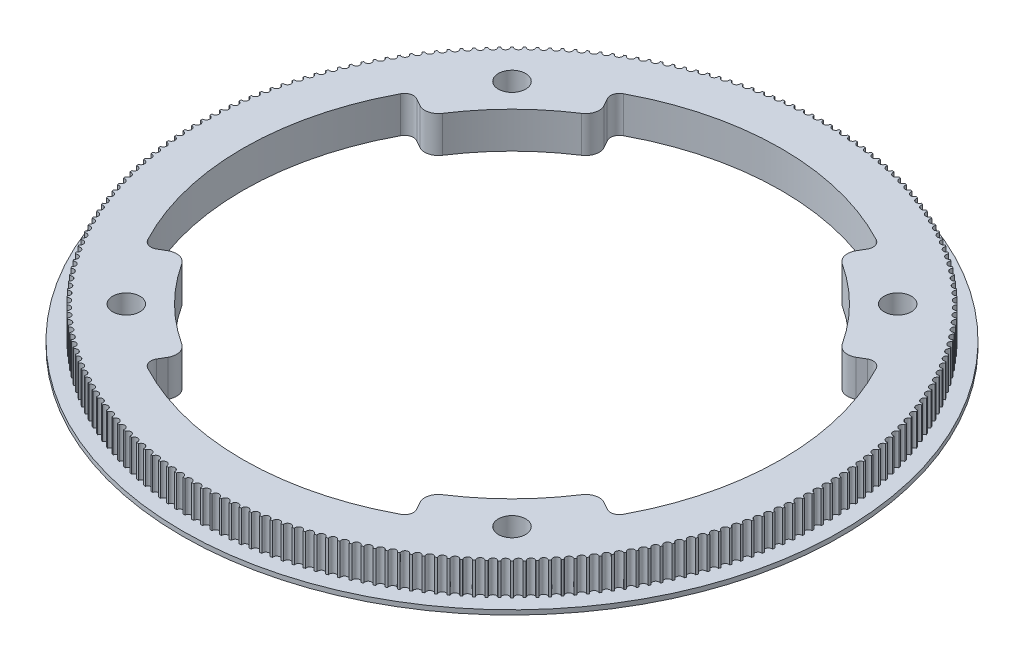
from build123d import *

# Parameters (mm, degrees)
BOSS_EXTRUDE1_DEPTH = 7
SKETCH3_R           = 72.5
BOSS_EXTRUDE3_DEPTH = 1
SKETCH6_R           = 3
CUT_EXTRUDE3_DEPTH  = 103.842111997
SKETCH7_R           = 50
CUT_EXTRUDE4_DEPTH  = 103.842111997
CUT_EXTRUDE5_DEPTH  = 103.842111997
SKETCH11_R          = 52.5
CUT_EXTRUDE6_DEPTH  = 10
FILLET1_R           = 3
FILLET2_R           = 2


with BuildPart() as part:
    # Sketch1 → Boss-Extrude1 (new body)
    with BuildSketch(Plane(origin=(0, 0, 0), x_dir=(1, 0, 0), z_dir=(0, 1, 0))):
        with BuildLine():
            ThreePointArc((-0.759988559, 69.250829904), (-0.988925477, 69.247938969), (-1.217851586, 69.244291191))
            ThreePointArc((-1.217851586, 69.244291191), (-1.955946699, 68.467067248), (-2.737208847, 69.200886647))
            ThreePointArc((-2.737208847, 69.200886647), (-2.965969848, 69.191459356), (-3.194698434, 69.18127584))
            ThreePointArc((-3.194698434, 69.18127584), (-3.9102981, 68.383291773), (-4.712196627, 69.094502154))
            ThreePointArc((-4.712196627, 69.094502154), (-4.940595132, 69.078546197), (-5.168939639, 69.061835249))
            ThreePointArc((-5.168939639, 69.061835249), (-5.861460206, 68.243741905), (-6.683341073, 68.931763195))
            ThreePointArc((-6.683341073, 68.931763195), (-6.911190796, 68.909291585), (-7.138964984, 68.886066835))
            ThreePointArc((-7.138964984, 68.886066835), (-7.80784162, 68.048531463), (-8.64903449, 68.7128025))
            ThreePointArc((-8.64903449, 68.7128025), (-8.876149594, 68.683833566), (-9.103167686, 68.654113956))
            ThreePointArc((-9.103167686, 68.654113956), (-9.747854848, 67.797819662), (-10.60767363, 68.437798658))
            ThreePointArc((-10.60767363, 68.437798658), (-10.833868876, 68.402356028), (-11.059945715, 68.366165797))
            ThreePointArc((-11.059945715, 68.366165797), (-11.679917584, 67.491810986), (-12.557660999, 68.106975966))
            ThreePointArc((-12.557660999, 68.106975966), (-12.7827519, 68.065088547), (-13.007703093, 68.022457213))
            ThreePointArc((-13.007703093, 68.022457213), (-13.602454013, 67.130755022), (-14.49740616, 67.720604247))
            ThreePointArc((-14.49740616, 67.720604247), (-14.721209128, 67.672306203), (-14.944851201, 67.623268537))
            ThreePointArc((-14.944851201, 67.623268537), (-15.513896085, 66.714946251), (-16.425327028, 67.278998633))
            ThreePointArc((-16.425327028, 67.278998633), (-16.647659527, 67.224329355), (-16.869810075, 67.168925353))
            ThreePointArc((-16.869810075, 67.168925353), (-17.412684801, 66.244723813), (-18.339851164, 66.782519302))
            ThreePointArc((-18.339851164, 66.782519302), (-18.560531855, 66.721523381), (-18.78100969, 66.65979823))
            ThreePointArc((-18.78100969, 66.65979823), (-19.297271481, 65.720471228), (-20.239417055, 66.23157119))
            ThreePointArc((-20.239417055, 66.23157119), (-20.458265948, 66.164298375), (-20.676891243, 66.096302419))
            ThreePointArc((-20.676891243, 66.096302419), (-21.16611903, 65.142616084), (-22.122475387, 65.626603659))
            ThreePointArc((-22.122475387, 65.626603659), (-22.339313986, 65.553108818), (-22.555908428, 65.478897517))
            ThreePointArc((-22.555908428, 65.478897517), (-23.017703188, 64.511629687), (-23.98749031, 64.968110128))
            ThreePointArc((-23.98749031, 64.968110128), (-24.202141758, 64.888453205), (-24.41652869, 64.808087086))
            ThreePointArc((-24.41652869, 64.808087086), (-24.850513778, 63.828026681), (-25.832940692, 64.256627675))
            ThreePointArc((-25.832940692, 64.256627675), (-26.045229917, 64.170873639), (-26.257234481, 64.08441825))
            ThreePointArc((-26.257234481, 64.08441825), (-26.663055932, 63.09236462), (-27.657321357, 63.492736595))
            ThreePointArc((-27.657321357, 63.492736595), (-27.867075212, 63.400955388), (-28.076524495, 63.308481243))
            ThreePointArc((-28.076524495, 63.308481243), (-28.453851316, 62.305243522), (-29.459144315, 62.677059928))
            ThreePointArc((-29.459144315, 62.677059928), (-29.666191722, 62.579326408), (-29.872914893, 62.48090893))
            ThreePointArc((-29.872914893, 62.48090893), (-30.22143933, 61.467305373), (-31.236939971, 61.810262952))
            ThreePointArc((-31.236939971, 61.810262952), (-31.441112059, 61.706656833), (-31.644940513, 61.602376293))
            ThreePointArc((-31.644940513, 61.602376293), (-31.964378304, 60.579233609), (-32.989258331, 60.893052639))
            ThreePointArc((-32.989258331, 60.893052639), (-33.190388575, 60.783658422), (-33.391156066, 60.673599873))
            ThreePointArc((-33.391156066, 60.673599873), (-33.681246674, 59.641752552), (-34.71467018, 59.926177079))
            ThreePointArc((-34.71467018, 59.926177079), (-34.912594534, 59.811083989), (-35.110137313, 59.695337195))
            ThreePointArc((-35.110137313, 59.695337195), (-35.370644135, 58.655626827), (-36.411768245, 58.910424869))
            ThreePointArc((-36.411768245, 58.910424869), (-36.60632528, 58.789726777), (-36.800482228, 58.668386144))
            ThreePointArc((-36.800482228, 58.668386144), (-37.031192792, 57.621660731), (-38.079168349, 57.846624472))
            ThreePointArc((-38.079168349, 57.846624472), (-38.270199382, 57.72041982), (-38.460812142, 57.593584316))
            ThreePointArc((-38.460812142, 57.593584316), (-38.661538276, 56.540697582), (-39.715510538, 56.735643538))
            ThreePointArc((-39.715510538, 56.735643538), (-39.902859761, 56.604035262), (-40.089772867, 56.471808334))
            ThreePointArc((-40.089772867, 56.471808334), (-40.260350856, 55.41361903), (-41.319460187, 55.5783882))
            ThreePointArc((-41.319460187, 55.5783882), (-41.502974794, 55.44148364), (-41.686035797, 55.303973135))
            ThreePointArc((-41.686035797, 55.303973135), (-41.826326516, 54.241344334), (-42.889709091, 54.375802331))
            ThreePointArc((-42.889709091, 54.375802331), (-43.069239406, 54.233713149), (-43.248298998, 54.091031223))
            ThreePointArc((-43.248298998, 54.091031223), (-43.358188024, 53.024829621), (-44.424976533, 53.128866777))
            ThreePointArc((-44.424976533, 53.128866777), (-44.600376129, 52.981708864), (-44.775288267, 52.833971889))
            ThreePointArc((-44.775288267, 52.833971889), (-44.854685972, 51.765067095), (-45.924010327, 51.838598558))
            ThreePointArc((-45.924010327, 51.838598558), (-46.095136145, 51.686491937), (-46.265758168, 51.533820411))
            ThreePointArc((-46.265758168, 51.533820411), (-46.314599794, 50.463084239), (-47.38558784, 50.506050034))
            ThreePointArc((-47.38558784, 50.506050034), (-47.552300307, 50.349118766), (-47.718493053, 50.191637209))
            ThreePointArc((-47.718493053, 50.191637209), (-47.736738765, 49.119942967), (-48.808516988, 49.132308051))
            ThreePointArc((-48.808516988, 49.132308051), (-48.970680131, 48.970680131), (-49.132308051, 48.808516988))
            ThreePointArc((-49.132308051, 48.808516988), (-49.119942967, 47.736738765), (-50.191637209, 47.718493053))
            ThreePointArc((-50.191637209, 47.718493053), (-50.349118766, 47.552300307), (-50.506050034, 47.38558784))
            ThreePointArc((-50.506050034, 47.38558784), (-50.463084239, 46.314599794), (-51.533820411, 46.265758168))
            ThreePointArc((-51.533820411, 46.265758168), (-51.686491937, 46.095136145), (-51.838598558, 45.924010327))
            ThreePointArc((-51.838598558, 45.924010327), (-51.765067095, 44.854685972), (-52.833971889, 44.775288267))
            ThreePointArc((-52.833971889, 44.775288267), (-52.981708864, 44.600376129), (-53.128866777, 44.424976533))
            ThreePointArc((-53.128866777, 44.424976533), (-53.024829621, 43.358188024), (-54.091031223, 43.248298998))
            ThreePointArc((-54.091031223, 43.248298998), (-54.233713149, 43.069239406), (-54.375802331, 42.889709091))
            ThreePointArc((-54.375802331, 42.889709091), (-54.241344334, 41.826326516), (-55.303973135, 41.686035797))
            ThreePointArc((-55.303973135, 41.686035797), (-55.44148364, 41.502974794), (-55.5783882, 41.319460187))
            ThreePointArc((-55.5783882, 41.319460187), (-55.41361903, 40.260350856), (-56.471808334, 40.089772867))
            ThreePointArc((-56.471808334, 40.089772867), (-56.604035262, 39.902859761), (-56.735643538, 39.715510538))
            ThreePointArc((-56.735643538, 39.715510538), (-56.540697582, 38.661538276), (-57.593584316, 38.460812142))
            ThreePointArc((-57.593584316, 38.460812142), (-57.72041982, 38.270199382), (-57.846624472, 38.079168349))
            ThreePointArc((-57.846624472, 38.079168349), (-57.621660731, 37.031192792), (-58.668386144, 36.800482228))
            ThreePointArc((-58.668386144, 36.800482228), (-58.789726777, 36.60632528), (-58.910424869, 36.411768245))
            ThreePointArc((-58.910424869, 36.411768245), (-58.655626827, 35.370644135), (-59.695337195, 35.110137313))
            ThreePointArc((-59.695337195, 35.110137313), (-59.811083989, 34.912594534), (-59.926177079, 34.71467018))
            ThreePointArc((-59.926177079, 34.71467018), (-59.641752552, 33.681246674), (-60.673599873, 33.391156066))
            ThreePointArc((-60.673599873, 33.391156066), (-60.783658422, 33.190388575), (-60.893052639, 32.989258331))
            ThreePointArc((-60.893052639, 32.989258331), (-60.579233609, 31.964378304), (-61.602376293, 31.644940513))
            ThreePointArc((-61.602376293, 31.644940513), (-61.706656833, 31.441112059), (-61.810262952, 31.236939971))
            ThreePointArc((-61.810262952, 31.236939971), (-61.467305373, 30.22143933), (-62.48090893, 29.872914893))
            ThreePointArc((-62.48090893, 29.872914893), (-62.579326408, 29.666191722), (-62.677059928, 29.459144315))
            ThreePointArc((-62.677059928, 29.459144315), (-62.305243522, 28.453851316), (-63.308481243, 28.076524495))
            ThreePointArc((-63.308481243, 28.076524495), (-63.400955388, 27.867075212), (-63.492736595, 27.657321357))
            ThreePointArc((-63.492736595, 27.657321357), (-63.09236462, 26.663055932), (-64.08441825, 26.257234481))
            ThreePointArc((-64.08441825, 26.257234481), (-64.170873639, 26.045229917), (-64.256627675, 25.832940692))
            ThreePointArc((-64.256627675, 25.832940692), (-63.828026681, 24.850513778), (-64.808087086, 24.41652869))
            ThreePointArc((-64.808087086, 24.41652869), (-64.888453205, 24.202141758), (-64.968110128, 23.98749031))
            ThreePointArc((-64.968110128, 23.98749031), (-64.511629687, 23.017703188), (-65.478897517, 22.555908428))
            ThreePointArc((-65.478897517, 22.555908428), (-65.553108818, 22.339313986), (-65.626603659, 22.122475387))
            ThreePointArc((-65.626603659, 22.122475387), (-65.142616084, 21.16611903), (-66.096302419, 20.676891243))
            ThreePointArc((-66.096302419, 20.676891243), (-66.164298375, 20.458265948), (-66.23157119, 20.239417055))
            ThreePointArc((-66.23157119, 20.239417055), (-65.720471228, 19.297271481), (-66.65979823, 18.78100969))
            ThreePointArc((-66.65979823, 18.78100969), (-66.721523381, 18.560531855), (-66.782519302, 18.339851164))
            ThreePointArc((-66.782519302, 18.339851164), (-66.244723813, 17.412684801), (-67.168925353, 16.869810075))
            ThreePointArc((-67.168925353, 16.869810075), (-67.224329355, 16.647659527), (-67.278998633, 16.425327028))
            ThreePointArc((-67.278998633, 16.425327028), (-66.714946251, 15.513896085), (-67.623268537, 14.944851201))
            ThreePointArc((-67.623268537, 14.944851201), (-67.672306203, 14.721209128), (-67.720604247, 14.49740616))
            ThreePointArc((-67.720604247, 14.49740616), (-67.130755022, 13.602454013), (-68.022457213, 13.007703093))
            ThreePointArc((-68.022457213, 13.007703093), (-68.065088547, 12.7827519), (-68.106975966, 12.557660999))
            ThreePointArc((-68.106975966, 12.557660999), (-67.491810986, 11.679917584), (-68.366165797, 11.059945715))
            ThreePointArc((-68.366165797, 11.059945715), (-68.402356028, 10.833868876), (-68.437798658, 10.60767363))
            ThreePointArc((-68.437798658, 10.60767363), (-67.797819662, 9.747854848), (-68.654113956, 9.103167686))
            ThreePointArc((-68.654113956, 9.103167686), (-68.683833566, 8.876149594), (-68.7128025, 8.64903449))
            ThreePointArc((-68.7128025, 8.64903449), (-68.048531463, 7.80784162), (-68.886066835, 7.138964984))
            ThreePointArc((-68.886066835, 7.138964984), (-68.909291585, 6.911190796), (-68.931763195, 6.683341073))
            ThreePointArc((-68.931763195, 6.683341073), (-68.243741905, 5.861460206), (-69.061835249, 5.168939639))
            ThreePointArc((-69.061835249, 5.168939639), (-69.078546197, 4.940595132), (-69.094502154, 4.712196627))
            ThreePointArc((-69.094502154, 4.712196627), (-68.383291773, 3.9102981), (-69.18127584, 3.194698434))
            ThreePointArc((-69.18127584, 3.194698434), (-69.191459356, 2.965969848), (-69.200886647, 2.737208847))
            ThreePointArc((-69.200886647, 2.737208847), (-68.467067248, 1.955946699), (-69.244291191, 1.217851586))
            ThreePointArc((-69.244291191, 1.217851586), (-69.247938969, 0.988925477), (-69.250829904, 0.759988559))
            ThreePointArc((-69.250829904, 0.759988559), (-68.495, 0), (-69.250829904, -0.759988559))
            ThreePointArc((-69.250829904, -0.759988559), (-69.247938969, -0.988925477), (-69.244291191, -1.217851586))
            ThreePointArc((-69.244291191, -1.217851586), (-68.467067248, -1.955946699), (-69.200886647, -2.737208847))
            ThreePointArc((-69.200886647, -2.737208847), (-69.191459356, -2.965969848), (-69.18127584, -3.194698434))
            ThreePointArc((-69.18127584, -3.194698434), (-68.383291773, -3.9102981), (-69.094502154, -4.712196627))
            ThreePointArc((-69.094502154, -4.712196627), (-69.078546197, -4.940595132), (-69.061835249, -5.168939639))
            ThreePointArc((-69.061835249, -5.168939639), (-68.243741905, -5.861460206), (-68.931763195, -6.683341073))
            ThreePointArc((-68.931763195, -6.683341073), (-68.909291585, -6.911190796), (-68.886066835, -7.138964984))
            ThreePointArc((-68.886066835, -7.138964984), (-68.048531463, -7.80784162), (-68.7128025, -8.64903449))
            ThreePointArc((-68.7128025, -8.64903449), (-68.683833566, -8.876149594), (-68.654113956, -9.103167686))
            ThreePointArc((-68.654113956, -9.103167686), (-67.797819662, -9.747854848), (-68.437798658, -10.60767363))
            ThreePointArc((-68.437798658, -10.60767363), (-68.402356028, -10.833868876), (-68.366165797, -11.059945715))
            ThreePointArc((-68.366165797, -11.059945715), (-67.491810986, -11.679917584), (-68.106975966, -12.557660999))
            ThreePointArc((-68.106975966, -12.557660999), (-68.065088547, -12.7827519), (-68.022457213, -13.007703093))
            ThreePointArc((-68.022457213, -13.007703093), (-67.130755022, -13.602454013), (-67.720604247, -14.49740616))
            ThreePointArc((-67.720604247, -14.49740616), (-67.672306203, -14.721209128), (-67.623268537, -14.944851201))
            ThreePointArc((-67.623268537, -14.944851201), (-66.714946251, -15.513896085), (-67.278998633, -16.425327028))
            ThreePointArc((-67.278998633, -16.425327028), (-67.224329355, -16.647659527), (-67.168925353, -16.869810075))
            ThreePointArc((-67.168925353, -16.869810075), (-66.244723813, -17.412684801), (-66.782519302, -18.339851164))
            ThreePointArc((-66.782519302, -18.339851164), (-66.721523381, -18.560531855), (-66.65979823, -18.78100969))
            ThreePointArc((-66.65979823, -18.78100969), (-65.720471228, -19.297271481), (-66.23157119, -20.239417055))
            ThreePointArc((-66.23157119, -20.239417055), (-66.164298375, -20.458265948), (-66.096302419, -20.676891243))
            ThreePointArc((-66.096302419, -20.676891243), (-65.142616084, -21.16611903), (-65.626603659, -22.122475387))
            ThreePointArc((-65.626603659, -22.122475387), (-65.553108818, -22.339313986), (-65.478897517, -22.555908428))
            ThreePointArc((-65.478897517, -22.555908428), (-64.511629687, -23.017703188), (-64.968110128, -23.98749031))
            ThreePointArc((-64.968110128, -23.98749031), (-64.888453205, -24.202141758), (-64.808087086, -24.41652869))
            ThreePointArc((-64.808087086, -24.41652869), (-63.828026681, -24.850513778), (-64.256627675, -25.832940692))
            ThreePointArc((-64.256627675, -25.832940692), (-64.170873639, -26.045229917), (-64.08441825, -26.257234481))
            ThreePointArc((-64.08441825, -26.257234481), (-63.09236462, -26.663055932), (-63.492736595, -27.657321357))
            ThreePointArc((-63.492736595, -27.657321357), (-63.400955388, -27.867075212), (-63.308481243, -28.076524495))
            ThreePointArc((-63.308481243, -28.076524495), (-62.305243522, -28.453851316), (-62.677059928, -29.459144315))
            ThreePointArc((-62.677059928, -29.459144315), (-62.579326408, -29.666191722), (-62.48090893, -29.872914893))
            ThreePointArc((-62.48090893, -29.872914893), (-61.467305373, -30.22143933), (-61.810262952, -31.236939971))
            ThreePointArc((-61.810262952, -31.236939971), (-61.706656833, -31.441112059), (-61.602376293, -31.644940513))
            ThreePointArc((-61.602376293, -31.644940513), (-60.579233609, -31.964378304), (-60.893052639, -32.989258331))
            ThreePointArc((-60.893052639, -32.989258331), (-60.783658422, -33.190388575), (-60.673599873, -33.391156066))
            ThreePointArc((-60.673599873, -33.391156066), (-59.641752552, -33.681246674), (-59.926177079, -34.71467018))
            ThreePointArc((-59.926177079, -34.71467018), (-59.811083989, -34.912594534), (-59.695337195, -35.110137313))
            ThreePointArc((-59.695337195, -35.110137313), (-58.655626827, -35.370644135), (-58.910424869, -36.411768245))
            ThreePointArc((-58.910424869, -36.411768245), (-58.789726777, -36.60632528), (-58.668386144, -36.800482228))
            ThreePointArc((-58.668386144, -36.800482228), (-57.621660731, -37.031192792), (-57.846624472, -38.079168349))
            ThreePointArc((-57.846624472, -38.079168349), (-57.72041982, -38.270199382), (-57.593584316, -38.460812142))
            ThreePointArc((-57.593584316, -38.460812142), (-56.540697582, -38.661538276), (-56.735643538, -39.715510538))
            ThreePointArc((-56.735643538, -39.715510538), (-56.604035262, -39.902859761), (-56.471808334, -40.089772867))
            ThreePointArc((-56.471808334, -40.089772867), (-55.41361903, -40.260350856), (-55.5783882, -41.319460187))
            ThreePointArc((-55.5783882, -41.319460187), (-55.44148364, -41.502974794), (-55.303973135, -41.686035797))
            ThreePointArc((-55.303973135, -41.686035797), (-54.241344334, -41.826326516), (-54.375802331, -42.889709091))
            ThreePointArc((-54.375802331, -42.889709091), (-54.233713149, -43.069239406), (-54.091031223, -43.248298998))
            ThreePointArc((-54.091031223, -43.248298998), (-53.024829621, -43.358188024), (-53.128866777, -44.424976533))
            ThreePointArc((-53.128866777, -44.424976533), (-52.981708864, -44.600376129), (-52.833971889, -44.775288267))
            ThreePointArc((-52.833971889, -44.775288267), (-51.765067095, -44.854685972), (-51.838598558, -45.924010327))
            ThreePointArc((-51.838598558, -45.924010327), (-51.686491937, -46.095136145), (-51.533820411, -46.265758168))
            ThreePointArc((-51.533820411, -46.265758168), (-50.463084239, -46.314599794), (-50.506050034, -47.38558784))
            ThreePointArc((-50.506050034, -47.38558784), (-50.349118766, -47.552300307), (-50.191637209, -47.718493053))
            ThreePointArc((-50.191637209, -47.718493053), (-49.119942967, -47.736738765), (-49.132308051, -48.808516988))
            ThreePointArc((-49.132308051, -48.808516988), (-48.970680131, -48.970680131), (-48.808516988, -49.132308051))
            ThreePointArc((-48.808516988, -49.132308051), (-47.736738765, -49.119942967), (-47.718493053, -50.191637209))
            ThreePointArc((-47.718493053, -50.191637209), (-47.552300307, -50.349118766), (-47.38558784, -50.506050034))
            ThreePointArc((-47.38558784, -50.506050034), (-46.314599794, -50.463084239), (-46.265758168, -51.533820411))
            ThreePointArc((-46.265758168, -51.533820411), (-46.095136145, -51.686491937), (-45.924010327, -51.838598558))
            ThreePointArc((-45.924010327, -51.838598558), (-44.854685972, -51.765067095), (-44.775288267, -52.833971889))
            ThreePointArc((-44.775288267, -52.833971889), (-44.600376129, -52.981708864), (-44.424976533, -53.128866777))
            ThreePointArc((-44.424976533, -53.128866777), (-43.358188024, -53.024829621), (-43.248298998, -54.091031223))
            ThreePointArc((-43.248298998, -54.091031223), (-43.069239406, -54.233713149), (-42.889709091, -54.375802331))
            ThreePointArc((-42.889709091, -54.375802331), (-41.826326516, -54.241344334), (-41.686035797, -55.303973135))
            ThreePointArc((-41.686035797, -55.303973135), (-41.502974794, -55.44148364), (-41.319460187, -55.5783882))
            ThreePointArc((-41.319460187, -55.5783882), (-40.260350856, -55.41361903), (-40.089772867, -56.471808334))
            ThreePointArc((-40.089772867, -56.471808334), (-39.902859761, -56.604035262), (-39.715510538, -56.735643538))
            ThreePointArc((-39.715510538, -56.735643538), (-38.661538276, -56.540697582), (-38.460812142, -57.593584316))
            ThreePointArc((-38.460812142, -57.593584316), (-38.270199382, -57.72041982), (-38.079168349, -57.846624472))
            ThreePointArc((-38.079168349, -57.846624472), (-37.031192792, -57.621660731), (-36.800482228, -58.668386144))
            ThreePointArc((-36.800482228, -58.668386144), (-36.60632528, -58.789726777), (-36.411768245, -58.910424869))
            ThreePointArc((-36.411768245, -58.910424869), (-35.370644135, -58.655626827), (-35.110137313, -59.695337195))
            ThreePointArc((-35.110137313, -59.695337195), (-34.912594534, -59.811083989), (-34.71467018, -59.926177079))
            ThreePointArc((-34.71467018, -59.926177079), (-33.681246674, -59.641752552), (-33.391156066, -60.673599873))
            ThreePointArc((-33.391156066, -60.673599873), (-33.190388575, -60.783658422), (-32.989258331, -60.893052639))
            ThreePointArc((-32.989258331, -60.893052639), (-31.964378304, -60.579233609), (-31.644940513, -61.602376293))
            ThreePointArc((-31.644940513, -61.602376293), (-31.441112059, -61.706656833), (-31.236939971, -61.810262952))
            ThreePointArc((-31.236939971, -61.810262952), (-30.22143933, -61.467305373), (-29.872914893, -62.48090893))
            ThreePointArc((-29.872914893, -62.48090893), (-29.666191722, -62.579326408), (-29.459144315, -62.677059928))
            ThreePointArc((-29.459144315, -62.677059928), (-28.453851316, -62.305243522), (-28.076524495, -63.308481243))
            ThreePointArc((-28.076524495, -63.308481243), (-27.867075212, -63.400955388), (-27.657321357, -63.492736595))
            ThreePointArc((-27.657321357, -63.492736595), (-26.663055932, -63.09236462), (-26.257234481, -64.08441825))
            ThreePointArc((-26.257234481, -64.08441825), (-26.045229917, -64.170873639), (-25.832940692, -64.256627675))
            ThreePointArc((-25.832940692, -64.256627675), (-24.850513778, -63.828026681), (-24.41652869, -64.808087086))
            ThreePointArc((-24.41652869, -64.808087086), (-24.202141758, -64.888453205), (-23.98749031, -64.968110128))
            ThreePointArc((-23.98749031, -64.968110128), (-23.017703188, -64.511629687), (-22.555908428, -65.478897517))
            ThreePointArc((-22.555908428, -65.478897517), (-22.339313986, -65.553108818), (-22.122475387, -65.626603659))
            ThreePointArc((-22.122475387, -65.626603659), (-21.16611903, -65.142616084), (-20.676891243, -66.096302419))
            ThreePointArc((-20.676891243, -66.096302419), (-20.458265948, -66.164298375), (-20.239417055, -66.23157119))
            ThreePointArc((-20.239417055, -66.23157119), (-19.297271481, -65.720471228), (-18.78100969, -66.65979823))
            ThreePointArc((-18.78100969, -66.65979823), (-18.560531855, -66.721523381), (-18.339851164, -66.782519302))
            ThreePointArc((-18.339851164, -66.782519302), (-17.412684801, -66.244723813), (-16.869810075, -67.168925353))
            ThreePointArc((-16.869810075, -67.168925353), (-16.647659527, -67.224329355), (-16.425327028, -67.278998633))
            ThreePointArc((-16.425327028, -67.278998633), (-15.513896085, -66.714946251), (-14.944851201, -67.623268537))
            ThreePointArc((-14.944851201, -67.623268537), (-14.721209128, -67.672306203), (-14.49740616, -67.720604247))
            ThreePointArc((-14.49740616, -67.720604247), (-13.602454013, -67.130755022), (-13.007703093, -68.022457213))
            ThreePointArc((-13.007703093, -68.022457213), (-12.7827519, -68.065088547), (-12.557660999, -68.106975966))
            ThreePointArc((-12.557660999, -68.106975966), (-11.679917584, -67.491810986), (-11.059945715, -68.366165797))
            ThreePointArc((-11.059945715, -68.366165797), (-10.833868876, -68.402356028), (-10.60767363, -68.437798658))
            ThreePointArc((-10.60767363, -68.437798658), (-9.747854848, -67.797819662), (-9.103167686, -68.654113956))
            ThreePointArc((-9.103167686, -68.654113956), (-8.876149594, -68.683833566), (-8.64903449, -68.7128025))
            ThreePointArc((-8.64903449, -68.7128025), (-7.80784162, -68.048531463), (-7.138964984, -68.886066835))
            ThreePointArc((-7.138964984, -68.886066835), (-6.911190796, -68.909291585), (-6.683341073, -68.931763195))
            ThreePointArc((-6.683341073, -68.931763195), (-5.861460206, -68.243741905), (-5.168939639, -69.061835249))
            ThreePointArc((-5.168939639, -69.061835249), (-4.940595132, -69.078546197), (-4.712196627, -69.094502154))
            ThreePointArc((-4.712196627, -69.094502154), (-3.9102981, -68.383291773), (-3.194698434, -69.18127584))
            ThreePointArc((-3.194698434, -69.18127584), (-2.965969848, -69.191459356), (-2.737208847, -69.200886647))
            ThreePointArc((-2.737208847, -69.200886647), (-1.955946699, -68.467067248), (-1.217851586, -69.244291191))
            ThreePointArc((-1.217851586, -69.244291191), (-0.988925477, -69.247938969), (-0.759988559, -69.250829904))
            ThreePointArc((-0.759988559, -69.250829904), (0, -68.495), (0.759988559, -69.250829904))
            ThreePointArc((0.759988559, -69.250829904), (0.988925477, -69.247938969), (1.217851586, -69.244291191))
            ThreePointArc((1.217851586, -69.244291191), (1.955946699, -68.467067248), (2.737208847, -69.200886647))
            ThreePointArc((2.737208847, -69.200886647), (2.965969848, -69.191459356), (3.194698434, -69.18127584))
            ThreePointArc((3.194698434, -69.18127584), (3.9102981, -68.383291773), (4.712196627, -69.094502154))
            ThreePointArc((4.712196627, -69.094502154), (4.940595132, -69.078546197), (5.168939639, -69.061835249))
            ThreePointArc((5.168939639, -69.061835249), (5.861460206, -68.243741905), (6.683341073, -68.931763195))
            ThreePointArc((6.683341073, -68.931763195), (6.911190796, -68.909291585), (7.138964984, -68.886066835))
            ThreePointArc((7.138964984, -68.886066835), (7.80784162, -68.048531463), (8.64903449, -68.7128025))
            ThreePointArc((8.64903449, -68.7128025), (8.876149594, -68.683833566), (9.103167686, -68.654113956))
            ThreePointArc((9.103167686, -68.654113956), (9.747854848, -67.797819662), (10.60767363, -68.437798658))
            ThreePointArc((10.60767363, -68.437798658), (10.833868876, -68.402356028), (11.059945715, -68.366165797))
            ThreePointArc((11.059945715, -68.366165797), (11.679917584, -67.491810986), (12.557660999, -68.106975966))
            ThreePointArc((12.557660999, -68.106975966), (12.7827519, -68.065088547), (13.007703093, -68.022457213))
            ThreePointArc((13.007703093, -68.022457213), (13.602454013, -67.130755022), (14.49740616, -67.720604247))
            ThreePointArc((14.49740616, -67.720604247), (14.721209128, -67.672306203), (14.944851201, -67.623268537))
            ThreePointArc((14.944851201, -67.623268537), (15.513896085, -66.714946251), (16.425327028, -67.278998633))
            ThreePointArc((16.425327028, -67.278998633), (16.647659527, -67.224329355), (16.869810075, -67.168925353))
            ThreePointArc((16.869810075, -67.168925353), (17.412684801, -66.244723813), (18.339851164, -66.782519302))
            ThreePointArc((18.339851164, -66.782519302), (18.560531855, -66.721523381), (18.78100969, -66.65979823))
            ThreePointArc((18.78100969, -66.65979823), (19.297271481, -65.720471228), (20.239417055, -66.23157119))
            ThreePointArc((20.239417055, -66.23157119), (20.458265948, -66.164298375), (20.676891243, -66.096302419))
            ThreePointArc((20.676891243, -66.096302419), (21.16611903, -65.142616084), (22.122475387, -65.626603659))
            ThreePointArc((22.122475387, -65.626603659), (22.339313986, -65.553108818), (22.555908428, -65.478897517))
            ThreePointArc((22.555908428, -65.478897517), (23.017703188, -64.511629687), (23.98749031, -64.968110128))
            ThreePointArc((23.98749031, -64.968110128), (24.202141758, -64.888453205), (24.41652869, -64.808087086))
            ThreePointArc((24.41652869, -64.808087086), (24.850513778, -63.828026681), (25.832940692, -64.256627675))
            ThreePointArc((25.832940692, -64.256627675), (26.045229917, -64.170873639), (26.257234481, -64.08441825))
            ThreePointArc((26.257234481, -64.08441825), (26.663055932, -63.09236462), (27.657321357, -63.492736595))
            ThreePointArc((27.657321357, -63.492736595), (27.867075212, -63.400955388), (28.076524495, -63.308481243))
            ThreePointArc((28.076524495, -63.308481243), (28.453851316, -62.305243522), (29.459144315, -62.677059928))
            ThreePointArc((29.459144315, -62.677059928), (29.666191722, -62.579326408), (29.872914893, -62.48090893))
            ThreePointArc((29.872914893, -62.48090893), (30.22143933, -61.467305373), (31.236939971, -61.810262952))
            ThreePointArc((31.236939971, -61.810262952), (31.441112059, -61.706656833), (31.644940513, -61.602376293))
            ThreePointArc((31.644940513, -61.602376293), (31.964378304, -60.579233609), (32.989258331, -60.893052639))
            ThreePointArc((32.989258331, -60.893052639), (33.190388575, -60.783658422), (33.391156066, -60.673599873))
            ThreePointArc((33.391156066, -60.673599873), (33.681246674, -59.641752552), (34.71467018, -59.926177079))
            ThreePointArc((34.71467018, -59.926177079), (34.912594534, -59.811083989), (35.110137313, -59.695337195))
            ThreePointArc((35.110137313, -59.695337195), (35.370644135, -58.655626827), (36.411768245, -58.910424869))
            ThreePointArc((36.411768245, -58.910424869), (36.60632528, -58.789726777), (36.800482228, -58.668386144))
            ThreePointArc((36.800482228, -58.668386144), (37.031192792, -57.621660731), (38.079168349, -57.846624472))
            ThreePointArc((38.079168349, -57.846624472), (38.270199382, -57.72041982), (38.460812142, -57.593584316))
            ThreePointArc((38.460812142, -57.593584316), (38.661538276, -56.540697582), (39.715510538, -56.735643538))
            ThreePointArc((39.715510538, -56.735643538), (39.902859761, -56.604035262), (40.089772867, -56.471808334))
            ThreePointArc((40.089772867, -56.471808334), (40.260350856, -55.41361903), (41.319460187, -55.5783882))
            ThreePointArc((41.319460187, -55.5783882), (41.502974794, -55.44148364), (41.686035797, -55.303973135))
            ThreePointArc((41.686035797, -55.303973135), (41.826326516, -54.241344334), (42.889709091, -54.375802331))
            ThreePointArc((42.889709091, -54.375802331), (43.069239406, -54.233713149), (43.248298998, -54.091031223))
            ThreePointArc((43.248298998, -54.091031223), (43.358188024, -53.024829621), (44.424976533, -53.128866777))
            ThreePointArc((44.424976533, -53.128866777), (44.600376129, -52.981708864), (44.775288267, -52.833971889))
            ThreePointArc((44.775288267, -52.833971889), (44.854685972, -51.765067095), (45.924010327, -51.838598558))
            ThreePointArc((45.924010327, -51.838598558), (46.095136145, -51.686491937), (46.265758168, -51.533820411))
            ThreePointArc((46.265758168, -51.533820411), (46.314599794, -50.463084239), (47.38558784, -50.506050034))
            ThreePointArc((47.38558784, -50.506050034), (47.552300307, -50.349118766), (47.718493053, -50.191637209))
            ThreePointArc((47.718493053, -50.191637209), (47.736738765, -49.119942967), (48.808516988, -49.132308051))
            ThreePointArc((48.808516988, -49.132308051), (48.970680131, -48.970680131), (49.132308051, -48.808516988))
            ThreePointArc((49.132308051, -48.808516988), (49.119942967, -47.736738765), (50.191637209, -47.718493053))
            ThreePointArc((50.191637209, -47.718493053), (50.349118766, -47.552300307), (50.506050034, -47.38558784))
            ThreePointArc((50.506050034, -47.38558784), (50.463084239, -46.314599794), (51.533820411, -46.265758168))
            ThreePointArc((51.533820411, -46.265758168), (51.686491937, -46.095136145), (51.838598558, -45.924010327))
            ThreePointArc((51.838598558, -45.924010327), (51.765067095, -44.854685972), (52.833971889, -44.775288267))
            ThreePointArc((52.833971889, -44.775288267), (52.981708864, -44.600376129), (53.128866777, -44.424976533))
            ThreePointArc((53.128866777, -44.424976533), (53.024829621, -43.358188024), (54.091031223, -43.248298998))
            ThreePointArc((54.091031223, -43.248298998), (54.233713149, -43.069239406), (54.375802331, -42.889709091))
            ThreePointArc((54.375802331, -42.889709091), (54.241344334, -41.826326516), (55.303973135, -41.686035797))
            ThreePointArc((55.303973135, -41.686035797), (55.44148364, -41.502974794), (55.5783882, -41.319460187))
            ThreePointArc((55.5783882, -41.319460187), (55.41361903, -40.260350856), (56.471808334, -40.089772867))
            ThreePointArc((56.471808334, -40.089772867), (56.604035262, -39.902859761), (56.735643538, -39.715510538))
            ThreePointArc((56.735643538, -39.715510538), (56.540697582, -38.661538276), (57.593584316, -38.460812142))
            ThreePointArc((57.593584316, -38.460812142), (57.72041982, -38.270199382), (57.846624472, -38.079168349))
            ThreePointArc((57.846624472, -38.079168349), (57.621660731, -37.031192792), (58.668386144, -36.800482228))
            ThreePointArc((58.668386144, -36.800482228), (58.789726777, -36.60632528), (58.910424869, -36.411768245))
            ThreePointArc((58.910424869, -36.411768245), (58.655626827, -35.370644135), (59.695337195, -35.110137313))
            ThreePointArc((59.695337195, -35.110137313), (59.811083989, -34.912594534), (59.926177079, -34.71467018))
            ThreePointArc((59.926177079, -34.71467018), (59.641752552, -33.681246674), (60.673599873, -33.391156066))
            ThreePointArc((60.673599873, -33.391156066), (60.783658422, -33.190388575), (60.893052639, -32.989258331))
            ThreePointArc((60.893052639, -32.989258331), (60.579233609, -31.964378304), (61.602376293, -31.644940513))
            ThreePointArc((61.602376293, -31.644940513), (61.706656833, -31.441112059), (61.810262952, -31.236939971))
            ThreePointArc((61.810262952, -31.236939971), (61.467305373, -30.22143933), (62.48090893, -29.872914893))
            ThreePointArc((62.48090893, -29.872914893), (62.579326408, -29.666191722), (62.677059928, -29.459144315))
            ThreePointArc((62.677059928, -29.459144315), (62.305243522, -28.453851316), (63.308481243, -28.076524495))
            ThreePointArc((63.308481243, -28.076524495), (63.400955388, -27.867075212), (63.492736595, -27.657321357))
            ThreePointArc((63.492736595, -27.657321357), (63.09236462, -26.663055932), (64.08441825, -26.257234481))
            ThreePointArc((64.08441825, -26.257234481), (64.170873639, -26.045229917), (64.256627675, -25.832940692))
            ThreePointArc((64.256627675, -25.832940692), (63.828026681, -24.850513778), (64.808087086, -24.41652869))
            ThreePointArc((64.808087086, -24.41652869), (64.888453205, -24.202141758), (64.968110128, -23.98749031))
            ThreePointArc((64.968110128, -23.98749031), (64.511629687, -23.017703188), (65.478897517, -22.555908428))
            ThreePointArc((65.478897517, -22.555908428), (65.553108818, -22.339313986), (65.626603659, -22.122475387))
            ThreePointArc((65.626603659, -22.122475387), (65.142616084, -21.16611903), (66.096302419, -20.676891243))
            ThreePointArc((66.096302419, -20.676891243), (66.164298375, -20.458265948), (66.23157119, -20.239417055))
            ThreePointArc((66.23157119, -20.239417055), (65.720471228, -19.297271481), (66.65979823, -18.78100969))
            ThreePointArc((66.65979823, -18.78100969), (66.721523381, -18.560531855), (66.782519302, -18.339851164))
            ThreePointArc((66.782519302, -18.339851164), (66.244723813, -17.412684801), (67.168925353, -16.869810075))
            ThreePointArc((67.168925353, -16.869810075), (67.224329355, -16.647659527), (67.278998633, -16.425327028))
            ThreePointArc((67.278998633, -16.425327028), (66.714946251, -15.513896085), (67.623268537, -14.944851201))
            ThreePointArc((67.623268537, -14.944851201), (67.672306203, -14.721209128), (67.720604247, -14.49740616))
            ThreePointArc((67.720604247, -14.49740616), (67.130755022, -13.602454013), (68.022457213, -13.007703093))
            ThreePointArc((68.022457213, -13.007703093), (68.065088547, -12.7827519), (68.106975966, -12.557660999))
            ThreePointArc((68.106975966, -12.557660999), (67.491810986, -11.679917584), (68.366165797, -11.059945715))
            ThreePointArc((68.366165797, -11.059945715), (68.402356028, -10.833868876), (68.437798658, -10.60767363))
            ThreePointArc((68.437798658, -10.60767363), (67.797819662, -9.747854848), (68.654113956, -9.103167686))
            ThreePointArc((68.654113956, -9.103167686), (68.683833566, -8.876149594), (68.7128025, -8.64903449))
            ThreePointArc((68.7128025, -8.64903449), (68.048531463, -7.80784162), (68.886066835, -7.138964984))
            ThreePointArc((68.886066835, -7.138964984), (68.909291585, -6.911190796), (68.931763195, -6.683341073))
            ThreePointArc((68.931763195, -6.683341073), (68.243741905, -5.861460206), (69.061835249, -5.168939639))
            ThreePointArc((69.061835249, -5.168939639), (69.078546197, -4.940595132), (69.094502154, -4.712196627))
            ThreePointArc((69.094502154, -4.712196627), (68.383291773, -3.9102981), (69.18127584, -3.194698434))
            ThreePointArc((69.18127584, -3.194698434), (69.191459356, -2.965969848), (69.200886647, -2.737208847))
            ThreePointArc((69.200886647, -2.737208847), (68.467067248, -1.955946699), (69.244291191, -1.217851586))
            ThreePointArc((69.244291191, -1.217851586), (69.247938969, -0.988925477), (69.250829904, -0.759988559))
            ThreePointArc((69.250829904, -0.759988559), (68.495, 0), (69.250829904, 0.759988559))
            ThreePointArc((69.250829904, 0.759988559), (69.247938969, 0.988925477), (69.244291191, 1.217851586))
            ThreePointArc((69.244291191, 1.217851586), (68.467067248, 1.955946699), (69.200886647, 2.737208847))
            ThreePointArc((69.200886647, 2.737208847), (69.191459356, 2.965969848), (69.18127584, 3.194698434))
            ThreePointArc((69.18127584, 3.194698434), (68.383291773, 3.9102981), (69.094502154, 4.712196627))
            ThreePointArc((69.094502154, 4.712196627), (69.078546197, 4.940595132), (69.061835249, 5.168939639))
            ThreePointArc((69.061835249, 5.168939639), (68.243741905, 5.861460206), (68.931763195, 6.683341073))
            ThreePointArc((68.931763195, 6.683341073), (68.909291585, 6.911190796), (68.886066835, 7.138964984))
            ThreePointArc((68.886066835, 7.138964984), (68.048531463, 7.80784162), (68.7128025, 8.64903449))
            ThreePointArc((68.7128025, 8.64903449), (68.683833566, 8.876149594), (68.654113956, 9.103167686))
            ThreePointArc((68.654113956, 9.103167686), (67.797819662, 9.747854848), (68.437798658, 10.60767363))
            ThreePointArc((68.437798658, 10.60767363), (68.402356028, 10.833868876), (68.366165797, 11.059945715))
            ThreePointArc((68.366165797, 11.059945715), (67.491810986, 11.679917584), (68.106975966, 12.557660999))
            ThreePointArc((68.106975966, 12.557660999), (68.065088547, 12.7827519), (68.022457213, 13.007703093))
            ThreePointArc((68.022457213, 13.007703093), (67.130755022, 13.602454013), (67.720604247, 14.49740616))
            ThreePointArc((67.720604247, 14.49740616), (67.672306203, 14.721209128), (67.623268537, 14.944851201))
            ThreePointArc((67.623268537, 14.944851201), (66.714946251, 15.513896085), (67.278998633, 16.425327028))
            ThreePointArc((67.278998633, 16.425327028), (67.224329355, 16.647659527), (67.168925353, 16.869810075))
            ThreePointArc((67.168925353, 16.869810075), (66.244723813, 17.412684801), (66.782519302, 18.339851164))
            ThreePointArc((66.782519302, 18.339851164), (66.721523381, 18.560531855), (66.65979823, 18.78100969))
            ThreePointArc((66.65979823, 18.78100969), (65.720471228, 19.297271481), (66.23157119, 20.239417055))
            ThreePointArc((66.23157119, 20.239417055), (66.164298375, 20.458265948), (66.096302419, 20.676891243))
            ThreePointArc((66.096302419, 20.676891243), (65.142616084, 21.16611903), (65.626603659, 22.122475387))
            ThreePointArc((65.626603659, 22.122475387), (65.553108818, 22.339313986), (65.478897517, 22.555908428))
            ThreePointArc((65.478897517, 22.555908428), (64.511629687, 23.017703188), (64.968110128, 23.98749031))
            ThreePointArc((64.968110128, 23.98749031), (64.888453205, 24.202141758), (64.808087086, 24.41652869))
            ThreePointArc((64.808087086, 24.41652869), (63.828026681, 24.850513778), (64.256627675, 25.832940692))
            ThreePointArc((64.256627675, 25.832940692), (64.170873639, 26.045229917), (64.08441825, 26.257234481))
            ThreePointArc((64.08441825, 26.257234481), (63.09236462, 26.663055932), (63.492736595, 27.657321357))
            ThreePointArc((63.492736595, 27.657321357), (63.400955388, 27.867075212), (63.308481243, 28.076524495))
            ThreePointArc((63.308481243, 28.076524495), (62.305243522, 28.453851316), (62.677059928, 29.459144315))
            ThreePointArc((62.677059928, 29.459144315), (62.579326408, 29.666191722), (62.48090893, 29.872914893))
            ThreePointArc((62.48090893, 29.872914893), (61.467305373, 30.22143933), (61.810262952, 31.236939971))
            ThreePointArc((61.810262952, 31.236939971), (61.706656833, 31.441112059), (61.602376293, 31.644940513))
            ThreePointArc((61.602376293, 31.644940513), (60.579233609, 31.964378304), (60.893052639, 32.989258331))
            ThreePointArc((60.893052639, 32.989258331), (60.783658422, 33.190388575), (60.673599873, 33.391156066))
            ThreePointArc((60.673599873, 33.391156066), (59.641752552, 33.681246674), (59.926177079, 34.71467018))
            ThreePointArc((59.926177079, 34.71467018), (59.811083989, 34.912594534), (59.695337195, 35.110137313))
            ThreePointArc((59.695337195, 35.110137313), (58.655626827, 35.370644135), (58.910424869, 36.411768245))
            ThreePointArc((58.910424869, 36.411768245), (58.789726777, 36.60632528), (58.668386144, 36.800482228))
            ThreePointArc((58.668386144, 36.800482228), (57.621660731, 37.031192792), (57.846624472, 38.079168349))
            ThreePointArc((57.846624472, 38.079168349), (57.72041982, 38.270199382), (57.593584316, 38.460812142))
            ThreePointArc((57.593584316, 38.460812142), (56.540697582, 38.661538276), (56.735643538, 39.715510538))
            ThreePointArc((56.735643538, 39.715510538), (56.604035262, 39.902859761), (56.471808334, 40.089772867))
            ThreePointArc((56.471808334, 40.089772867), (55.41361903, 40.260350856), (55.5783882, 41.319460187))
            ThreePointArc((55.5783882, 41.319460187), (55.44148364, 41.502974794), (55.303973135, 41.686035797))
            ThreePointArc((55.303973135, 41.686035797), (54.241344334, 41.826326516), (54.375802331, 42.889709091))
            ThreePointArc((54.375802331, 42.889709091), (54.233713149, 43.069239406), (54.091031223, 43.248298998))
            ThreePointArc((54.091031223, 43.248298998), (53.024829621, 43.358188024), (53.128866777, 44.424976533))
            ThreePointArc((53.128866777, 44.424976533), (52.981708864, 44.600376129), (52.833971889, 44.775288267))
            ThreePointArc((52.833971889, 44.775288267), (51.765067095, 44.854685972), (51.838598558, 45.924010327))
            ThreePointArc((51.838598558, 45.924010327), (51.686491937, 46.095136145), (51.533820411, 46.265758168))
            ThreePointArc((51.533820411, 46.265758168), (50.463084239, 46.314599794), (50.506050034, 47.38558784))
            ThreePointArc((50.506050034, 47.38558784), (50.349118766, 47.552300307), (50.191637209, 47.718493053))
            ThreePointArc((50.191637209, 47.718493053), (49.119942967, 47.736738765), (49.132308051, 48.808516988))
            ThreePointArc((49.132308051, 48.808516988), (48.970680131, 48.970680131), (48.808516988, 49.132308051))
            ThreePointArc((48.808516988, 49.132308051), (47.736738765, 49.119942967), (47.718493053, 50.191637209))
            ThreePointArc((47.718493053, 50.191637209), (47.552300307, 50.349118766), (47.38558784, 50.506050034))
            ThreePointArc((47.38558784, 50.506050034), (46.314599794, 50.463084239), (46.265758168, 51.533820411))
            ThreePointArc((46.265758168, 51.533820411), (46.095136145, 51.686491937), (45.924010327, 51.838598558))
            ThreePointArc((45.924010327, 51.838598558), (44.854685972, 51.765067095), (44.775288267, 52.833971889))
            ThreePointArc((44.775288267, 52.833971889), (44.600376129, 52.981708864), (44.424976533, 53.128866777))
            ThreePointArc((44.424976533, 53.128866777), (43.358188024, 53.024829621), (43.248298998, 54.091031223))
            ThreePointArc((43.248298998, 54.091031223), (43.069239406, 54.233713149), (42.889709091, 54.375802331))
            ThreePointArc((42.889709091, 54.375802331), (41.826326516, 54.241344334), (41.686035797, 55.303973135))
            ThreePointArc((41.686035797, 55.303973135), (41.502974794, 55.44148364), (41.319460187, 55.5783882))
            ThreePointArc((41.319460187, 55.5783882), (40.260350856, 55.41361903), (40.089772867, 56.471808334))
            ThreePointArc((40.089772867, 56.471808334), (39.902859761, 56.604035262), (39.715510538, 56.735643538))
            ThreePointArc((39.715510538, 56.735643538), (38.661538276, 56.540697582), (38.460812142, 57.593584316))
            ThreePointArc((38.460812142, 57.593584316), (38.270199382, 57.72041982), (38.079168349, 57.846624472))
            ThreePointArc((38.079168349, 57.846624472), (37.031192792, 57.621660731), (36.800482228, 58.668386144))
            ThreePointArc((36.800482228, 58.668386144), (36.60632528, 58.789726777), (36.411768245, 58.910424869))
            ThreePointArc((36.411768245, 58.910424869), (35.370644135, 58.655626827), (35.110137313, 59.695337195))
            ThreePointArc((35.110137313, 59.695337195), (34.912594534, 59.811083989), (34.71467018, 59.926177079))
            ThreePointArc((34.71467018, 59.926177079), (33.681246674, 59.641752552), (33.391156066, 60.673599873))
            ThreePointArc((33.391156066, 60.673599873), (33.190388575, 60.783658422), (32.989258331, 60.893052639))
            ThreePointArc((32.989258331, 60.893052639), (31.964378304, 60.579233609), (31.644940513, 61.602376293))
            ThreePointArc((31.644940513, 61.602376293), (31.441112059, 61.706656833), (31.236939971, 61.810262952))
            ThreePointArc((31.236939971, 61.810262952), (30.22143933, 61.467305373), (29.872914893, 62.48090893))
            ThreePointArc((29.872914893, 62.48090893), (29.666191722, 62.579326408), (29.459144315, 62.677059928))
            ThreePointArc((29.459144315, 62.677059928), (28.453851316, 62.305243522), (28.076524495, 63.308481243))
            ThreePointArc((28.076524495, 63.308481243), (27.867075212, 63.400955388), (27.657321357, 63.492736595))
            ThreePointArc((27.657321357, 63.492736595), (26.663055932, 63.09236462), (26.257234481, 64.08441825))
            ThreePointArc((26.257234481, 64.08441825), (26.045229917, 64.170873639), (25.832940692, 64.256627675))
            ThreePointArc((25.832940692, 64.256627675), (24.850513778, 63.828026681), (24.41652869, 64.808087086))
            ThreePointArc((24.41652869, 64.808087086), (24.202141758, 64.888453205), (23.98749031, 64.968110128))
            ThreePointArc((23.98749031, 64.968110128), (23.017703188, 64.511629687), (22.555908428, 65.478897517))
            ThreePointArc((22.555908428, 65.478897517), (22.339313986, 65.553108818), (22.122475387, 65.626603659))
            ThreePointArc((22.122475387, 65.626603659), (21.16611903, 65.142616084), (20.676891243, 66.096302419))
            ThreePointArc((20.676891243, 66.096302419), (20.458265948, 66.164298375), (20.239417055, 66.23157119))
            ThreePointArc((20.239417055, 66.23157119), (19.297271481, 65.720471228), (18.78100969, 66.65979823))
            ThreePointArc((18.78100969, 66.65979823), (18.560531855, 66.721523381), (18.339851164, 66.782519302))
            ThreePointArc((18.339851164, 66.782519302), (17.412684801, 66.244723813), (16.869810075, 67.168925353))
            ThreePointArc((16.869810075, 67.168925353), (16.647659527, 67.224329355), (16.425327028, 67.278998633))
            ThreePointArc((16.425327028, 67.278998633), (15.513896085, 66.714946251), (14.944851201, 67.623268537))
            ThreePointArc((14.944851201, 67.623268537), (14.721209128, 67.672306203), (14.49740616, 67.720604247))
            ThreePointArc((14.49740616, 67.720604247), (13.602454013, 67.130755022), (13.007703093, 68.022457213))
            ThreePointArc((13.007703093, 68.022457213), (12.7827519, 68.065088547), (12.557660999, 68.106975966))
            ThreePointArc((12.557660999, 68.106975966), (11.679917584, 67.491810986), (11.059945715, 68.366165797))
            ThreePointArc((11.059945715, 68.366165797), (10.833868876, 68.402356028), (10.60767363, 68.437798658))
            ThreePointArc((10.60767363, 68.437798658), (9.747854848, 67.797819662), (9.103167686, 68.654113956))
            ThreePointArc((9.103167686, 68.654113956), (8.876149594, 68.683833566), (8.64903449, 68.7128025))
            ThreePointArc((8.64903449, 68.7128025), (7.80784162, 68.048531463), (7.138964984, 68.886066835))
            ThreePointArc((7.138964984, 68.886066835), (6.911190796, 68.909291585), (6.683341073, 68.931763195))
            ThreePointArc((6.683341073, 68.931763195), (5.861460206, 68.243741905), (5.168939639, 69.061835249))
            ThreePointArc((5.168939639, 69.061835249), (4.940595132, 69.078546197), (4.712196627, 69.094502154))
            ThreePointArc((4.712196627, 69.094502154), (3.9102981, 68.383291773), (3.194698434, 69.18127584))
            ThreePointArc((3.194698434, 69.18127584), (2.965969848, 69.191459356), (2.737208847, 69.200886647))
            ThreePointArc((2.737208847, 69.200886647), (1.955946699, 68.467067248), (1.217851586, 69.244291191))
            ThreePointArc((1.217851586, 69.244291191), (0.988925477, 69.247938969), (0.759988559, 69.250829904))
            ThreePointArc((0.759988559, 69.250829904), (0, 68.495), (-0.759988559, 69.250829904))
        make_face()
    extrude(amount=BOSS_EXTRUDE1_DEPTH)

    # Sketch3 → Boss-Extrude3 (add)
    with BuildSketch(Plane.XZ):
        with Locations(Location((0, 0, 0), (0, 0, 270))):
            Circle(SKETCH3_R)
    extrude(amount=BOSS_EXTRUDE3_DEPTH)

    # Sketch6 → Cut-Extrude3 (cut, through all)
    with BuildSketch(Plane(origin=(0, 7, 0), x_dir=(1, 0, 0), z_dir=(0, 1, 0))):
        with Locations(Location((42.425, 42.425, 0), (0, 0, 270))):
            Circle(SKETCH6_R)
        with Locations(Location((42.425, -42.425, 0), (0, 0, 270))):
            Circle(SKETCH6_R)
        with Locations(Location((-42.425, -42.425, 0), (0, 0, 270))):
            Circle(SKETCH6_R)
        with Locations(Location((-42.425, 42.425, 0), (0, 0, 270))):
            Circle(SKETCH6_R)
    extrude(amount=-CUT_EXTRUDE3_DEPTH, mode=Mode.SUBTRACT)

    # Sketch7 → Cut-Extrude4 (cut, through all)
    with BuildSketch(Plane(origin=(0, 7, 0), x_dir=(1, 0, 0), z_dir=(0, 1, 0))):
        with Locations(Location((0, 0, 0), (0, 0, 270))):
            Circle(SKETCH7_R)
    extrude(amount=-CUT_EXTRUDE4_DEPTH, mode=Mode.SUBTRACT)

    # Sketch10 → Cut-Extrude5 (cut, through all)
    with BuildSketch(Plane(origin=(0, 7, 0), x_dir=(1, 0, 0), z_dir=(0, 1, 0))):
        with BuildLine():
            Line((-29.625, -51.312005174), (-25, -43.301270189))
            ThreePointArc((-25, -43.301270189), (0, -50), (25, -43.301270189))
            Line((25, -43.301270189), (29.625, -51.312005174))
            ThreePointArc((29.625, -51.312005174), (0, -59.25), (-29.625, -51.312005174))
        make_face()
        with BuildLine():
            Line((-43.301270189, -25), (-51.312005174, -29.625))
            ThreePointArc((-51.312005174, -29.625), (-59.25, 0), (-51.312005174, 29.625))
            Line((-51.312005174, 29.625), (-43.301270189, 25))
            ThreePointArc((-43.301270189, 25), (-50, 0), (-43.301270189, -25))
        make_face()
        with BuildLine():
            Line((43.301270189, -25), (51.312005174, -29.625))
            ThreePointArc((51.312005174, -29.625), (59.25, 0), (51.312005174, 29.625))
            Line((51.312005174, 29.625), (43.301270189, 25))
            ThreePointArc((43.301270189, 25), (50, 0), (43.301270189, -25))
        make_face()
        with BuildLine():
            Line((29.625, 51.312005174), (25, 43.301270189))
            ThreePointArc((25, 43.301270189), (0, 50), (-25, 43.301270189))
            Line((-25, 43.301270189), (-29.625, 51.312005174))
            ThreePointArc((-29.625, 51.312005174), (0, 59.25), (29.625, 51.312005174))
        make_face()
    extrude(amount=-CUT_EXTRUDE5_DEPTH, mode=Mode.SUBTRACT)

    # Sketch11 → Cut-Extrude6 (cut)
    with BuildSketch(Plane(origin=(0, 7, 0), x_dir=(1, 0, 0), z_dir=(0, 1, 0))):
        Circle(SKETCH11_R)
    extrude(amount=-CUT_EXTRUDE6_DEPTH, mode=Mode.SUBTRACT)

    # Fillet1
    fillet1_edges = [part.edges().sort_by_distance(p)[0] for p in [
        (-26.25, 3, -45.466333699),
        (45.466333699, 3, 26.25),
        (26.25, 3, 45.466333699),
        (-45.466333699, 3, 26.25),
        (-26.25, 3, 45.466333699),
        (45.466333699, 3, -26.25),
        (26.25, 3, -45.466333699),
        (-45.466333699, 3, -26.25),
    ]]
    fillet(fillet1_edges, radius=FILLET1_R)

    # Fillet2
    fillet2_edges = [part.edges().sort_by_distance(p)[0] for p in [
        (-51.312005174, 3, 29.625),
        (-51.312005174, 3, -29.625),
        (-29.625, 3, -51.312005174),
        (29.625, 3, -51.312005174),
        (29.625, 3, 51.312005174),
        (-29.625, 3, 51.312005174),
        (51.312005174, 3, -29.625),
        (51.312005174, 3, 29.625),
    ]]
    fillet(fillet2_edges, radius=FILLET2_R)


solid = part.part
